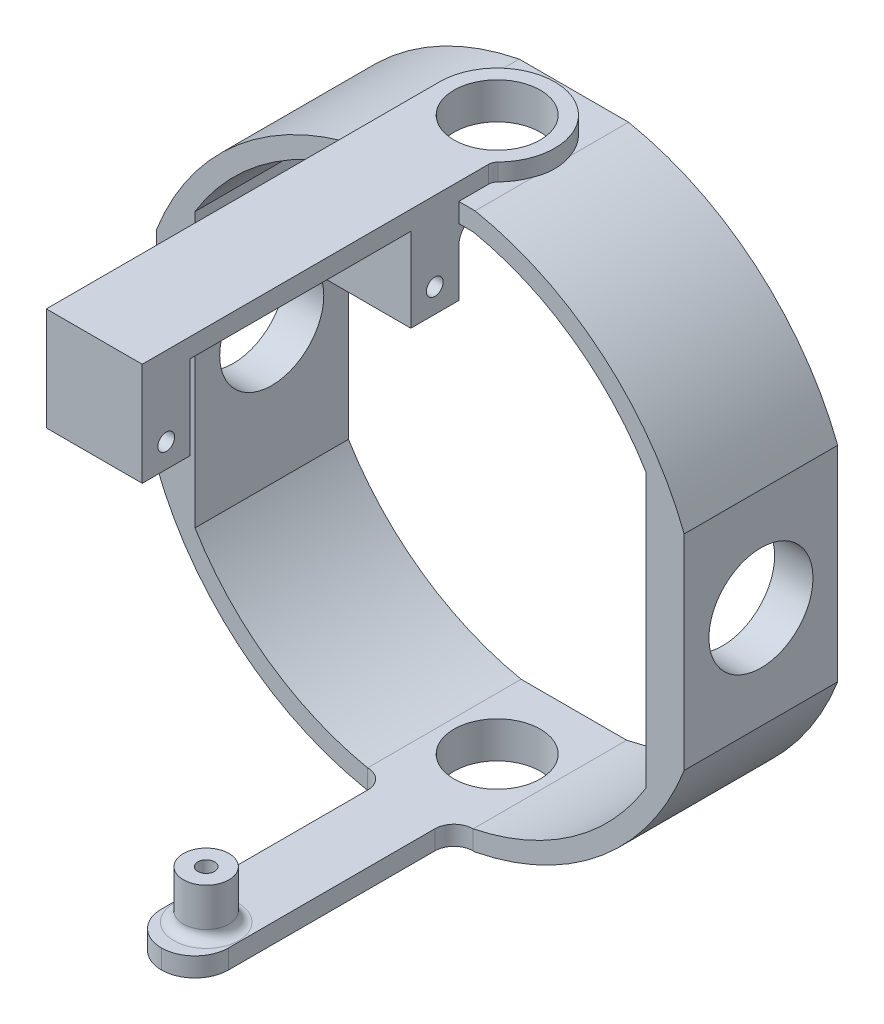
from build123d import *

# Parameters (mm, degrees)
BOSS_EXTRUDE1_DEPTH      = 16
SKETCH3_W                = 7
SKETCH3_H                = 2
BOSS_EXTRUDE2_DEPTH      = 27
FILLET1_R                = 3.5
CUT_EXTRUDE1_DEPTH       = 59.677317156
CUT_EXTRUDE1_DEPTH_BACK  = 59.677317156
SKETCH4_R                = 5.425
CUT_EXTRUDE2_DEPTH       = 59.677317156
CUT_EXTRUDE2_DEPTH_BACK  = 59.677317156
SKETCH5_R                = 4.5
SKETCH5_R_2              = 0.875
BOSS_EXTRUDE4_START      = -0.061001
SKETCH8_R                = 6
SKETCH8_R_2              = 4.5
BOSS_EXTRUDE4_DEPTH      = 1.861001
FILLET2_R                = 2
BOSS_EXTRUDE3_DEPTH      = 4
BOSS_EXTRUDE3_DEPTH_BACK = 6
SKETCH6_R                = 0.875
FILLET3_R                = 2
CUT_EXTRUDE3_DEPTH       = 65.050506352
CUT_EXTRUDE3_DEPTH_BACK  = 65.050506352
SKETCH9_R                = 4.5
BOSS_EXTRUDE5_START      = 5
SKETCH10_R               = 2.375
SKETCH10_R_2             = 0.875
BOSS_EXTRUDE5_DEPTH      = 5
FILLET4_R                = 1


with BuildPart() as part:
    # Sketch2 → Boss-Extrude1 (new body)
    # profile 1 of 3: a face of its own
    with BuildSketch(Plane(origin=(0, 0, 0), x_dir=(0, 1, 0), z_dir=(0, 0, 1))):
        with BuildLine():
            Line((10.677078252, -27.5), (-10.677078252, -27.5))
            ThreePointArc((-10.677078252, -27.5), (-22.611764912, -18.946189263), (-28.944387171, -5.698460434))
            Line((-28.944387171, -5.698460434), (-28.944387171, 5.698460434))
            ThreePointArc((-28.944387171, 5.698460434), (-22.611764912, 18.946189263), (-10.677078252, 27.5))
            Line((-10.677078252, 27.5), (10.677078252, 27.5))
            ThreePointArc((10.677078252, 27.5), (22.611764912, 18.946189263), (28.944387171, 5.698460434))
            Line((28.944387171, 5.698460434), (28.944387171, -5.698460434))
            ThreePointArc((28.944387171, -5.698460434), (22.611764912, -18.946189263), (10.677078252, -27.5))
        make_face()
        with BuildLine():
            ThreePointArc((10.295630141, -25.5), (21.135390281, -17.593898876), (26.944387171, -5.5))
            Line((26.944387171, -5.5), (26.944387171, 5.5))
            ThreePointArc((26.944387171, 5.5), (21.135390281, 17.593898876), (10.295630141, 25.5))
            Line((10.295630141, 25.5), (-10.295630141, 25.5))
            ThreePointArc((-10.295630141, 25.5), (-21.135390281, 17.593898876), (-26.944387171, 5.5))
            Line((-26.944387171, 5.5), (-26.944387171, -5.5))
            ThreePointArc((-26.944387171, -5.5), (-21.135390281, -17.593898876), (-10.295630141, -25.5))
            Line((-10.295630141, -25.5), (10.295630141, -25.5))
        make_face(mode=Mode.SUBTRACT)
    # profile 2 of 3: a face of its own
    with BuildSketch(Plane(origin=(0, 0, 0), x_dir=(0, 1, 0), z_dir=(0, 0, 1))):
        with BuildLine():
            Line((10.295630141, 25.5), (-10.295630141, 25.5))
            ThreePointArc((-10.295630141, 25.5), (-12.329862358, 24.580978301), (-14.282856857, 23.5))
            Line((-14.282856857, 23.5), (14.282856857, 23.5))
            ThreePointArc((14.282856857, 23.5), (12.329862358, 24.580978301), (10.295630141, 25.5))
        make_face()
    # profile 3 of 3: a face of its own
    with BuildSketch(Plane(origin=(0, 0, 0), x_dir=(0, 1, 0), z_dir=(0, 0, 1))):
        with BuildLine():
            Line((14.282856857, -23.5), (-14.282856857, -23.5))
            ThreePointArc((-14.282856857, -23.5), (-12.329862358, -24.580978301), (-10.295630141, -25.5))
            Line((-10.295630141, -25.5), (10.295630141, -25.5))
            ThreePointArc((10.295630141, -25.5), (12.329862358, -24.580978301), (14.282856857, -23.5))
        make_face()
    extrude(amount=BOSS_EXTRUDE1_DEPTH)

    # Sketch3 → Boss-Extrude2 (add)
    with BuildSketch(Plane.XY.offset(16)):
        with Locations((0, -27.944387171)):
            Rectangle(SKETCH3_W, SKETCH3_H)
    extrude(amount=BOSS_EXTRUDE2_DEPTH)

    # Fillet1
    fillet1_edges = [part.edges().sort_by_distance(p)[0] for p in [
        (-3.5, -27.944387171, 43),
        (3.5, -27.944387171, 43),
    ]]
    fillet(fillet1_edges, radius=FILLET1_R - 0.0001)  # a hair under: the kernel refuses the full size

    # Sketch4 → Cut-Extrude1 (cut, two sides: drawn at the far end of the back side and taken through both)
    with BuildSketch(Plane.YZ.offset(-CUT_EXTRUDE1_DEPTH_BACK)):
        with Locations(Location((0, 8, 0), (0, 0, 270))):
            Circle(SKETCH4_R)
    extrude(amount=CUT_EXTRUDE1_DEPTH + CUT_EXTRUDE1_DEPTH_BACK, mode=Mode.SUBTRACT)

    # Sketch5 → Cut-Extrude2 (cut, two sides: drawn at the far end of the back side and taken through both)
    with BuildSketch(Plane(origin=(0, 0, 0), x_dir=(-1, 0, 0), z_dir=(0, 1, 0)).offset(-CUT_EXTRUDE2_DEPTH_BACK)):
        with Locations(Location((0, 8, 0), (0, 0, 90))):
            Circle(SKETCH5_R)
        with Locations(Location((0, 38.333262144, 0), (0, 0, 90))):
            Circle(SKETCH5_R_2)
    extrude(amount=CUT_EXTRUDE2_DEPTH + CUT_EXTRUDE2_DEPTH_BACK, mode=Mode.SUBTRACT)

    # Sketch8 → Boss-Extrude4 (add)
    with BuildSketch(Plane.XZ.offset(28.944387171).offset(BOSS_EXTRUDE4_START)):
        with Locations(Location((0, 8, 0), (0, 0, 161.758103013))):
            Circle(SKETCH8_R)
        with Locations(Location((0, 8, 0), (0, 0, 90))):
            Circle(SKETCH8_R_2, mode=Mode.SUBTRACT)
    boss_extrude4 = extrude(amount=BOSS_EXTRUDE4_DEPTH)

    # Mirror1: Boss-Extrude4 across plane
    add(boss_extrude4.mirror(Plane.ZX))

    # Fillet2
    fillet2_edges = [part.edges().sort_by_distance(p)[0] for p in [
        (-3.5, -27.944387171, 16),
        (3.5, -27.944387171, 16),
    ]]
    fillet(fillet2_edges, radius=FILLET2_R)

    # Sketch6 → Boss-Extrude3 (add, two sides: drawn at the far end of the back side and taken through both)
    with BuildSketch(Plane.YZ.offset(-BOSS_EXTRUDE3_DEPTH_BACK)):
        Polygon((19.994387171, 49), (19.994387171, 44), (28.744387171, 44), (28.744387171, 21), (19.994387171, 21), (19.994387171, 16), (28.944387171, 16), (28.883386228, 8), (30.744387171, 8), (30.744387171, 16), (30.744387171, 49), align=None)
        with Locations(Location((22.494387171, 46.5, 0), (0, 0, 270))):
            Circle(SKETCH6_R, mode=Mode.SUBTRACT)
        with Locations(Location((22.494387171, 18.5, 0), (0, 0, 270))):
            Circle(SKETCH6_R, mode=Mode.SUBTRACT)
    extrude(amount=BOSS_EXTRUDE3_DEPTH + BOSS_EXTRUDE3_DEPTH_BACK)

    # Fillet3
    fillet3_edges = [part.edges().sort_by_distance(p)[0] for p in [
        (-5.750248483, 26.892092562, 16),
        (-0.75, 26.944387171, 16),
    ]]
    fillet(fillet3_edges, radius=FILLET3_R)

    # Sketch9 → Cut-Extrude3 (cut, two sides: drawn at the far end of the back side and taken through both)
    with BuildSketch(Plane(origin=(0, 0, 0), x_dir=(-1, 0, 0), z_dir=(0, 1, 0)).offset(-CUT_EXTRUDE3_DEPTH_BACK)):
        with Locations(Location((0, 8, 0), (0, 0, 90))):
            Circle(SKETCH9_R)
    extrude(amount=CUT_EXTRUDE3_DEPTH + CUT_EXTRUDE3_DEPTH_BACK, mode=Mode.SUBTRACT)

    # Sketch10 → Boss-Extrude5 (add)
    with BuildSketch(Plane(origin=(0, -26.944387171, 0), x_dir=(-1, 0, 0), z_dir=(0, 1, 0)).offset(BOSS_EXTRUDE5_START)):
        with Locations(Location((0, 38.333262144, 0), (0, 0, 90))):
            Circle(SKETCH10_R)
        with Locations(Location((0, 38.333262144, 0), (0, 0, 90))):
            Circle(SKETCH10_R_2, mode=Mode.SUBTRACT)
    extrude(amount=-BOSS_EXTRUDE5_DEPTH)

    # Fillet4
    fillet4_edges = [part.edges().sort_by_distance(p)[0] for p in [
        (4, 29.844387171, 12.472135955),
        (0, -26.944387171, 35.958262144),
    ]]
    fillet(fillet4_edges, radius=FILLET4_R)


solid = part.part
